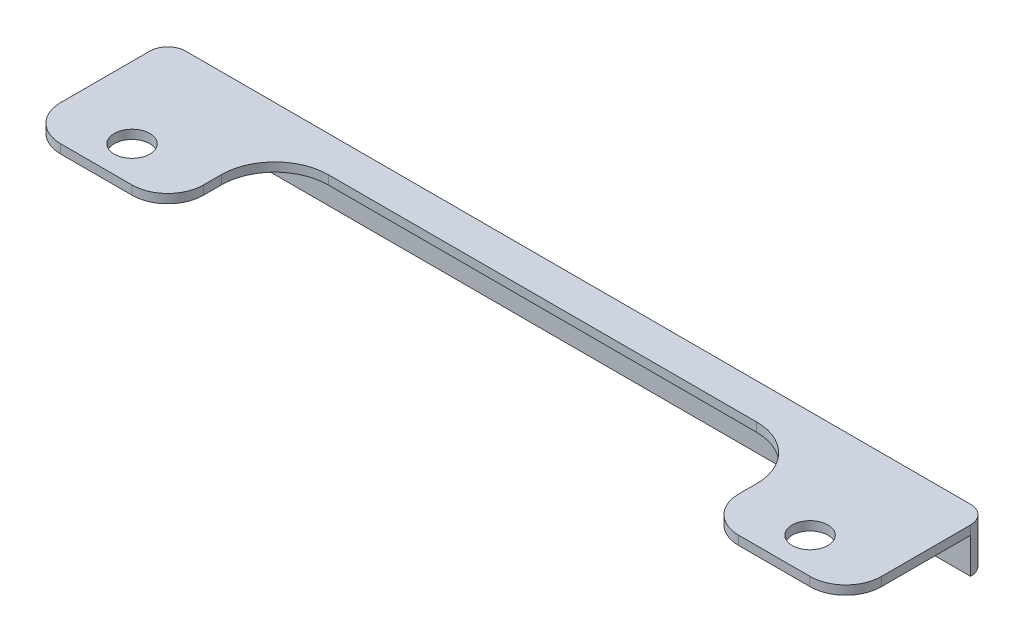
from build123d import *

# Parameters (mm, degrees)
BOSS_EXTRUDE2_DEPTH = 40
SKETCH2_W           = 50
SKETCH2_H           = 35
CUT_EXTRUDE1_DEPTH  = 45
SKETCH3_W           = 50
SKETCH3_H           = 35
CUT_EXTRUDE2_DEPTH  = 45
SKETCH4_W           = 150
SKETCH4_H           = 35
CUT_EXTRUDE3_DEPTH  = 5
CUT_EXTRUDE4_DEPTH  = 50
BOSS_EXTRUDE3_DEPTH = 2.5
BOSS_EXTRUDE4_START = -2.5
BOSS_EXTRUDE4_DEPTH = 2.5
SKETCH10_R          = 7.5
CUT_EXTRUDE5_DEPTH  = 50
CUT_EXTRUDE7_DEPTH  = 10
SKETCH12_W          = 250.559183642
SKETCH12_H          = 50.914019983
CUT_EXTRUDE8_DEPTH  = 10
SKETCH14_R          = 7.5
BOSS_EXTRUDE5_DEPTH = 2.5
SKETCH15_W          = 12.944399718
SKETCH15_H          = 51.5357406
SKETCH15_W_2        = 21.188165756
SKETCH15_H_2        = 60.611007318
CUT_EXTRUDE9_DEPTH  = 50
SKETCH17_W          = 230
SKETCH17_H          = 10
CUT_EXTRUDE10_DEPTH = 50
FILLET3_R           = 5
FILLET4_R           = 10
SKETCH18_R          = 5
CUT_EXTRUDE11_DEPTH = 50


with BuildPart() as part:
    # Sketch1 → Boss-Extrude2 (new body)
    with BuildSketch(Plane(origin=(0, 0, 0), x_dir=(1, 0, 0), z_dir=(0, 1, 0))):
        Polygon((36.951161, 103.273036008), (-88.048839, 103.273036008), (-88.048839, 53.273036008), (-38.048839, 53.273036008), (-38.048839, 93.273036008), (36.951161, 93.273036008), align=None)
        Polygon((161.951161, 103.273036008), (36.951161, 103.273036008), (36.951161, 93.273036008), (111.951161, 93.273036008), (111.951161, 53.273036008), (161.951161, 53.273036008), align=None)
    extrude(amount=-BOSS_EXTRUDE2_DEPTH)

    # Sketch2 → Cut-Extrude1 (cut)
    with BuildSketch(Plane.XY.offset(-53.273036008)):
        with Locations((-63.048839, -20)):
            Rectangle(SKETCH2_W, SKETCH2_H)
    extrude(amount=-CUT_EXTRUDE1_DEPTH, mode=Mode.SUBTRACT)

    # Sketch3 → Cut-Extrude2 (cut)
    with BuildSketch(Plane.XY.offset(-53.273036008)):
        with Locations((136.951161, -20)):
            Rectangle(SKETCH3_W, SKETCH3_H)
    extrude(amount=-CUT_EXTRUDE2_DEPTH, mode=Mode.SUBTRACT)

    # Sketch4 → Cut-Extrude3 (cut)
    with BuildSketch(Plane.XY.offset(-93.273036008)):
        with Locations((36.951161, -20)):
            Rectangle(SKETCH4_W, SKETCH4_H)
    extrude(amount=-CUT_EXTRUDE3_DEPTH, mode=Mode.SUBTRACT)

    # Sketch5 → Cut-Extrude4 (cut)
    with BuildSketch(Plane.XZ.offset(40)):
        with BuildLine():
            ThreePointArc((-80.548839, -103.273036008), (-85.852139859, -101.076336867), (-88.048839, -95.773036008))
            Line((-88.048839, -95.773036008), (-88.048839, -103.273036008))
            Line((-88.048839, -103.273036008), (-80.548839, -103.273036008))
        make_face()
        with BuildLine():
            ThreePointArc((-88.048839, -63.273036008), (-85.119906812, -56.201968196), (-78.048839, -53.273036008))
            Line((-78.048839, -53.273036008), (-88.048839, -53.273036008))
            Line((-88.048839, -53.273036008), (-88.048839, -63.273036008))
        make_face()
        with BuildLine():
            ThreePointArc((-48.048839, -53.273036008), (-40.977771189, -56.201968196), (-38.048839, -63.273036008))
            Line((-38.048839, -63.273036008), (-38.048839, -53.273036008))
            Line((-38.048839, -53.273036008), (-48.048839, -53.273036008))
        make_face()
        with BuildLine():
            Line((111.951161, -53.273036008), (111.951161, -63.273036008))
            ThreePointArc((111.951161, -63.273036008), (114.880093188, -56.201968196), (121.951161, -53.273036008))
            Line((121.951161, -53.273036008), (111.951161, -53.273036008))
        make_face()
        with BuildLine():
            Line((161.951161, -53.273036008), (151.951161, -53.273036008))
            ThreePointArc((151.951161, -53.273036008), (159.022228811, -56.201968196), (161.951161, -63.273036008))
            Line((161.951161, -63.273036008), (161.951161, -53.273036008))
        make_face()
        with BuildLine():
            ThreePointArc((161.951161, -95.773036008), (159.754461858, -101.076336867), (154.451161, -103.273036008))
            Line((154.451161, -103.273036008), (161.951161, -103.273036008))
            Line((161.951161, -103.273036008), (161.951161, -95.773036008))
        make_face()
    extrude(amount=-CUT_EXTRUDE4_DEPTH, mode=Mode.SUBTRACT)

    # Sketch8 → Boss-Extrude3 (add)
    with BuildSketch(Plane.XZ.offset(40)):
        with BuildLine():
            Line((-38.048839, -93.273036008), (-23.048839, -93.273036008))
            ThreePointArc((-23.048839, -93.273036008), (-33.655440718, -88.879637726), (-38.048839, -78.273036008))
            Line((-38.048839, -78.273036008), (-38.048839, -93.273036008))
        make_face()
        with BuildLine():
            ThreePointArc((111.951161, -78.273036008), (107.557762717, -88.879637726), (96.951161, -93.273036008))
            Line((96.951161, -93.273036008), (111.951161, -93.273036008))
            Line((111.951161, -93.273036008), (111.951161, -78.273036008))
        make_face()
    extrude(amount=-BOSS_EXTRUDE3_DEPTH)

    # Sketch9 → Boss-Extrude4 (add)
    with BuildSketch(Plane(origin=(0, 0, 0), x_dir=(1, 0, 0), z_dir=(0, 1, 0)).offset(BOSS_EXTRUDE4_START)):
        with BuildLine():
            Line((111.951161, 93.273036008), (96.951161, 93.273036008))
            ThreePointArc((96.951161, 93.273036008), (107.557762717, 88.879637726), (111.951161, 78.273036008))
            Line((111.951161, 78.273036008), (111.951161, 93.273036008))
        make_face()
        with BuildLine():
            ThreePointArc((-38.048839, 78.273036008), (-33.655440718, 88.879637726), (-23.048839, 93.273036008))
            Line((-23.048839, 93.273036008), (-38.048839, 93.273036008))
            Line((-38.048839, 93.273036008), (-38.048839, 78.273036008))
        make_face()
    extrude(amount=BOSS_EXTRUDE4_DEPTH)

    # Sketch10 → Cut-Extrude5 (cut)
    with BuildSketch(Plane(origin=(0, 0, 0), x_dir=(1, 0, 0), z_dir=(0, 1, 0))):
        with Locations(Location((-62.665129015, 73.273036008, 0), (0, 0, 270))):
            Circle(SKETCH10_R)
        with Locations(Location((136.567451014, 73.273036008, 0), (0, 0, 180))):
            Circle(SKETCH10_R)
    extrude(amount=-CUT_EXTRUDE5_DEPTH, mode=Mode.SUBTRACT)

    # Sketch11 → Cut-Extrude7 (cut)
    with BuildSketch(Plane.XY.offset(-98.273036008)):
        Polygon((161.522228811, -12.5), (-87.619906812, -12.5), (-87.619906812, -16.066465668), (-87.619906812, -37.5), (161.522228811, -37.5), (161.522228811, -16.066465668), align=None)
    extrude(amount=-CUT_EXTRUDE7_DEPTH, mode=Mode.SUBTRACT)


with BuildPart() as cut_extrude7_piece_1:
    # of the separate pieces the step leaves, piece 1, a body of its own (cut_extrude7_pieces)
    add(part.part.solids().sort_by_distance((-80.548839, -12.5, -103.273036008))[0])

    # Sketch14 → Boss-Extrude5 (add)
    with BuildSketch(Plane(origin=(0, 0, 0), x_dir=(1, 0, 0), z_dir=(0, 1, 0))):
        with Locations((-62.665129015, 73.273036008)):
            Circle(SKETCH14_R)
        with Locations((136.567451014, 73.273036008)):
            Circle(SKETCH14_R)
    extrude(amount=-BOSS_EXTRUDE5_DEPTH)

    # Sketch15 → Cut-Extrude9 (cut)
    with BuildSketch(Plane(origin=(0, 0, 0), x_dir=(1, 0, 0), z_dir=(0, 1, 0))):
        with Locations((-84.521038859, 78.400798504)):
            Rectangle(SKETCH15_W, SKETCH15_H)
        with Locations((162.545243878, 78.525177745)):
            Rectangle(SKETCH15_W_2, SKETCH15_H_2)
    extrude(amount=-CUT_EXTRUDE9_DEPTH, mode=Mode.SUBTRACT)

    # Sketch17 → Cut-Extrude10 (cut)
    with BuildSketch(Plane(origin=(0, 0, 0), x_dir=(1, 0, 0), z_dir=(0, 1, 0))):
        with Locations((36.951161, 58.273036008)):
            Rectangle(SKETCH17_W, SKETCH17_H)
    extrude(amount=-CUT_EXTRUDE10_DEPTH, mode=Mode.SUBTRACT)

    # Fillet3
    fillet3_edges = [cut_extrude7_piece_1.edges().sort_by_distance(p)[0] for p in [
        (151.951161, -6.25, -103.273036008),
        (-78.048839, -6.25, -103.273036008),
    ]]
    fillet(fillet3_edges, radius=FILLET3_R - 0.0001)  # a hair under: the kernel refuses the full size

    # Fillet4
    fillet4_edges = [cut_extrude7_piece_1.edges().sort_by_distance(p)[0] for p in [
        (151.951161, -1.25, -63.273036008),
        (-38.048839, -1.25, -63.273036008),
        (111.951161, -1.25, -63.273036008),
        (-78.048839, -1.25, -63.273036008),
    ]]
    fillet(fillet4_edges, radius=FILLET4_R)

    # Sketch18 → Cut-Extrude11 (cut)
    with BuildSketch(Plane.XZ.offset(2.5)):
        with Locations((131.951161, -73.273036008)):
            Circle(SKETCH18_R)
        with Locations((-58.048839, -73.273036008)):
            Circle(SKETCH18_R)
    extrude(amount=-CUT_EXTRUDE11_DEPTH, mode=Mode.SUBTRACT)


with BuildPart() as cut_extrude7_piece_2:
    # of the separate pieces the step leaves, piece 2, a body of its own (cut_extrude7_pieces)
    add(part.part.solids().sort_by_distance((154.451161, -40, -103.273036008))[0])

    # Sketch12 → Cut-Extrude8 (cut)
    with BuildSketch(Plane.XZ.offset(40)):
        with Locations((37.230752821, -78.730046)):
            Rectangle(SKETCH12_W, SKETCH12_H)
    extrude(amount=-CUT_EXTRUDE8_DEPTH, mode=Mode.SUBTRACT)


solid = cut_extrude7_piece_1.part
